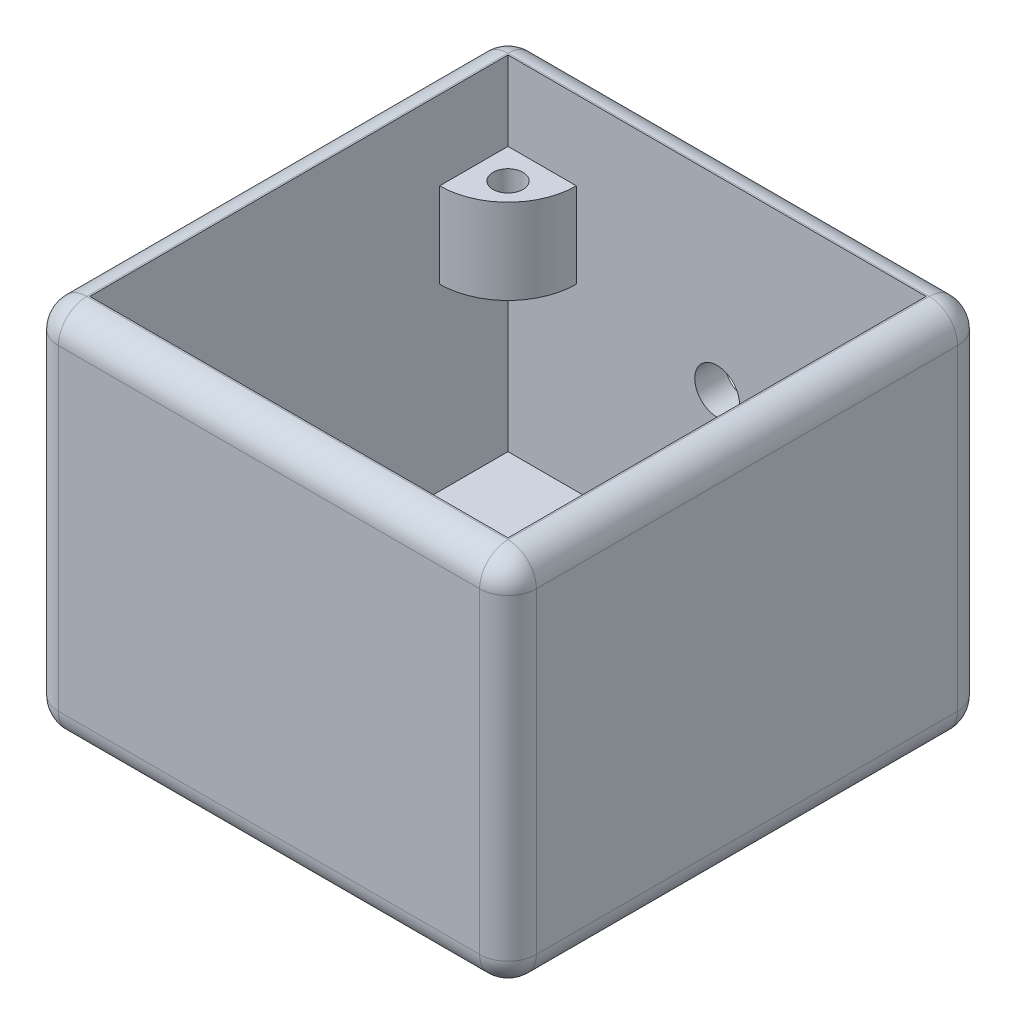
from build123d import *

# Parameters (mm, degrees)
SKETCH_1_W           = 32
SKETCH_1_H           = 32
EXTRUDE_1_DEPTH      = 25
SHELL_1_T            = -2
FILLET_2_R           = 1.9
SKETCH_6_R           = 1
EXTRUDE_3_DEPTH      = 5.7
SKETCH_12_R          = 1.5
CUT_EXTRUDE_5_DEPTH  = 2
SKETCH_13_W          = 3
SKETCH_13_H          = 1.1
CUT_EXTRUDE_7_DEPTH  = 0.8
SKETCH_15_W          = 17.5
SKETCH_15_H          = 1.079565451
CUT_EXTRUDE_8_DEPTH  = 0.5
CUT_EXTRUDE_12_DEPTH = 2
SKETCH_17_W          = 10.9
SKETCH_17_H          = 6.2
SKETCH_17_W_2        = 8.9
SKETCH_17_H_2        = 4.2
EXTRUDE_4_DEPTH      = 2.2
SKETCH_19_W          = 8.9
SKETCH_19_H          = 4.2
CUT_EXTRUDE_11_DEPTH = 2


with BuildPart() as part:
    # 草图1 → 凸台-拉伸1 (new body)
    with BuildSketch(Plane(origin=(0, 0, 0), x_dir=(1, 0, 0), z_dir=(0, 1, 0))):
        Rectangle(SKETCH_1_W, SKETCH_1_H)
    extrude(amount=EXTRUDE_1_DEPTH)

    # 抽壳1
    shell_1_openings = [part.faces().sort_by_distance(p)[0] for p in [
        (0, 25, 0),
    ]]
    offset(amount=SHELL_1_T, openings=shell_1_openings, kind=Kind.INTERSECTION)

    # 圆角2
    fillet_2_edges = [part.edges().sort_by_distance(p)[0] for p in [
        (-16, 25, 0),
        (0, 25, -16),
        (-16, 12.5, -16),
        (0, 0, -16),
        (-16, 0, 0),
        (16, 25, 0),
        (16, 12.5, -16),
        (16, 0, 0),
        (-16, 12.5, 16),
        (0, 25, 16),
        (16, 12.5, 16),
        (0, 0, 16),
    ]]
    fillet(fillet_2_edges, radius=FILLET_2_R)

    # 草图6 → 凸台-拉伸3 (add)
    # profile 1 of 4: a face of its own
    with BuildSketch(Plane(origin=(0, 19.7, 0), x_dir=(1, 0, 0), z_dir=(0, 1, 0))):
        with BuildLine():
            Line((-14, 14), (-9.422209932, 14))
            ThreePointArc((-9.422209932, 14), (-10.7630136, 10.7630136), (-14, 9.422209932))
            Line((-14, 9.422209932), (-14, 14))
        make_face()
        with Locations((-12, 12)):
            Circle(SKETCH_6_R, mode=Mode.SUBTRACT)
    # profile 2 of 4: a face of its own
    with BuildSketch(Plane(origin=(0, 19.7, 0), x_dir=(1, 0, 0), z_dir=(0, 1, 0))):
        with BuildLine():
            Line((14, 14), (14, 9.458479825))
            ThreePointArc((14, 9.458479825), (10.788660287, 10.788660287), (9.458479825, 14))
            Line((9.458479825, 14), (14, 14))
        make_face()
        with Locations((12, 12)):
            Circle(SKETCH_6_R, mode=Mode.SUBTRACT)
    # profile 3 of 4: a face of its own
    with BuildSketch(Plane(origin=(0, 19.7, 0), x_dir=(1, 0, 0), z_dir=(0, 1, 0))):
        with BuildLine():
            Line((-14, -9.417689546), (-14, -14))
            Line((-14, -14), (-9.417689546, -14))
            ThreePointArc((-9.417689546, -14), (-10.759817205, -10.759817205), (-14, -9.417689546))
        make_face()
        with Locations((-12, -12)):
            Circle(SKETCH_6_R, mode=Mode.SUBTRACT)
    # profile 4 of 4: a face of its own
    with BuildSketch(Plane(origin=(0, 19.7, 0), x_dir=(1, 0, 0), z_dir=(0, 1, 0))):
        with BuildLine():
            Line((9.370725518, -14), (14, -14))
            Line((14, -14), (14, -9.370725518))
            ThreePointArc((14, -9.370725518), (10.726608622, -10.726608622), (9.370725518, -14))
        make_face()
        with Locations((12, -12)):
            Circle(SKETCH_6_R, mode=Mode.SUBTRACT)
    extrude(amount=-EXTRUDE_3_DEPTH)

    # 草图12 → 切除-拉伸5 (cut)
    with BuildSketch(Plane(origin=(0, 0, -16), x_dir=(-1, 0, 0), z_dir=(0, 0, -1))):
        with Locations((0, 12.5)):
            Circle(SKETCH_12_R)
    extrude(amount=-CUT_EXTRUDE_5_DEPTH, mode=Mode.SUBTRACT)

    # 草图13 → 切除-拉伸7 (cut)
    with BuildSketch(Plane.ZY.offset(-14)):
        with Locations((-4, 2.55)):
            Rectangle(SKETCH_13_W, SKETCH_13_H)
        with Locations((10.5, 2.55)):
            Rectangle(SKETCH_13_W, SKETCH_13_H)
    extrude(amount=-CUT_EXTRUDE_7_DEPTH, mode=Mode.SUBTRACT)

    # 草图15 → 切除-拉伸8 (cut)
    with BuildSketch(Plane(origin=(-14, 0, 0), x_dir=(0, 0, -1), z_dir=(1, 0, 0))):
        with Locations((-3.25, 2.539782726)):
            Rectangle(SKETCH_15_W, SKETCH_15_H)
    extrude(amount=-CUT_EXTRUDE_8_DEPTH, mode=Mode.SUBTRACT)

    # 草图16 → 切除-拉伸12 (cut)
    with BuildSketch(Plane.ZY.offset(16)):
        with BuildLine():
            Line((0.1, 6.25), (6.4, 6.25))
            ThreePointArc((6.4, 6.25), (8.15, 4.5), (6.4, 2.75))
            Line((6.4, 2.75), (0.1, 2.75))
            ThreePointArc((0.1, 2.75), (-1.65, 4.5), (0.1, 6.25))
        make_face()
    extrude(amount=-CUT_EXTRUDE_12_DEPTH, mode=Mode.SUBTRACT)

    # 草图17 → 凸台-拉伸4 (add)
    with BuildSketch(Plane(origin=(0, 2, 0), x_dir=(1, 0, 0), z_dir=(0, 1, 0))):
        with Locations((-0.05, 10.9)):
            Rectangle(SKETCH_17_W, SKETCH_17_H)
        with Locations((-0.05, 10.9)):
            Rectangle(SKETCH_17_W_2, SKETCH_17_H_2, mode=Mode.SUBTRACT)
    extrude(amount=EXTRUDE_4_DEPTH)

    # 草图19 → 切除-拉伸11 (cut)
    with BuildSketch(Plane.XZ):
        with Locations((-0.05, -10.9)):
            Rectangle(SKETCH_19_W, SKETCH_19_H)
    extrude(amount=-CUT_EXTRUDE_11_DEPTH, mode=Mode.SUBTRACT)


solid = part.part
